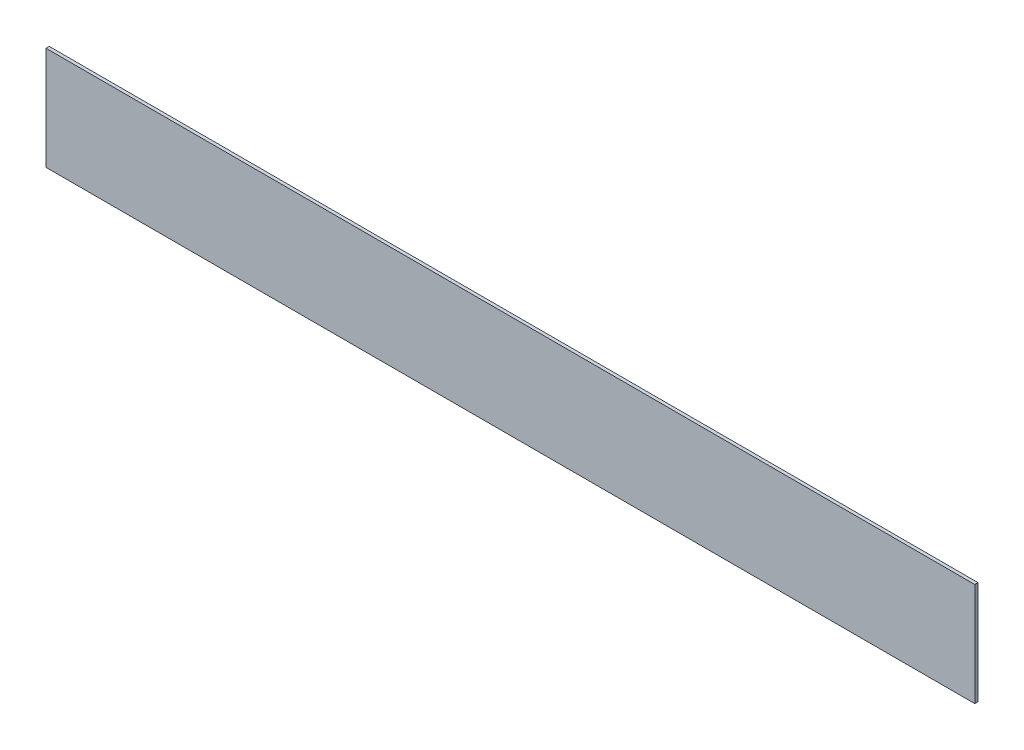
from build123d import *

# Parameters (mm, degrees)
SKETCH1_W           = 457.2
SKETCH1_H           = 50.8
BOSS_EXTRUDE1_DEPTH = 1.5875


with BuildPart() as part:
    # Sketch1 → Boss-Extrude1 (new body)
    with BuildSketch(Plane.XY):
        with Locations((228.6, 25.4)):
            Rectangle(SKETCH1_W, SKETCH1_H)
    extrude(amount=BOSS_EXTRUDE1_DEPTH)


solid = part.part
